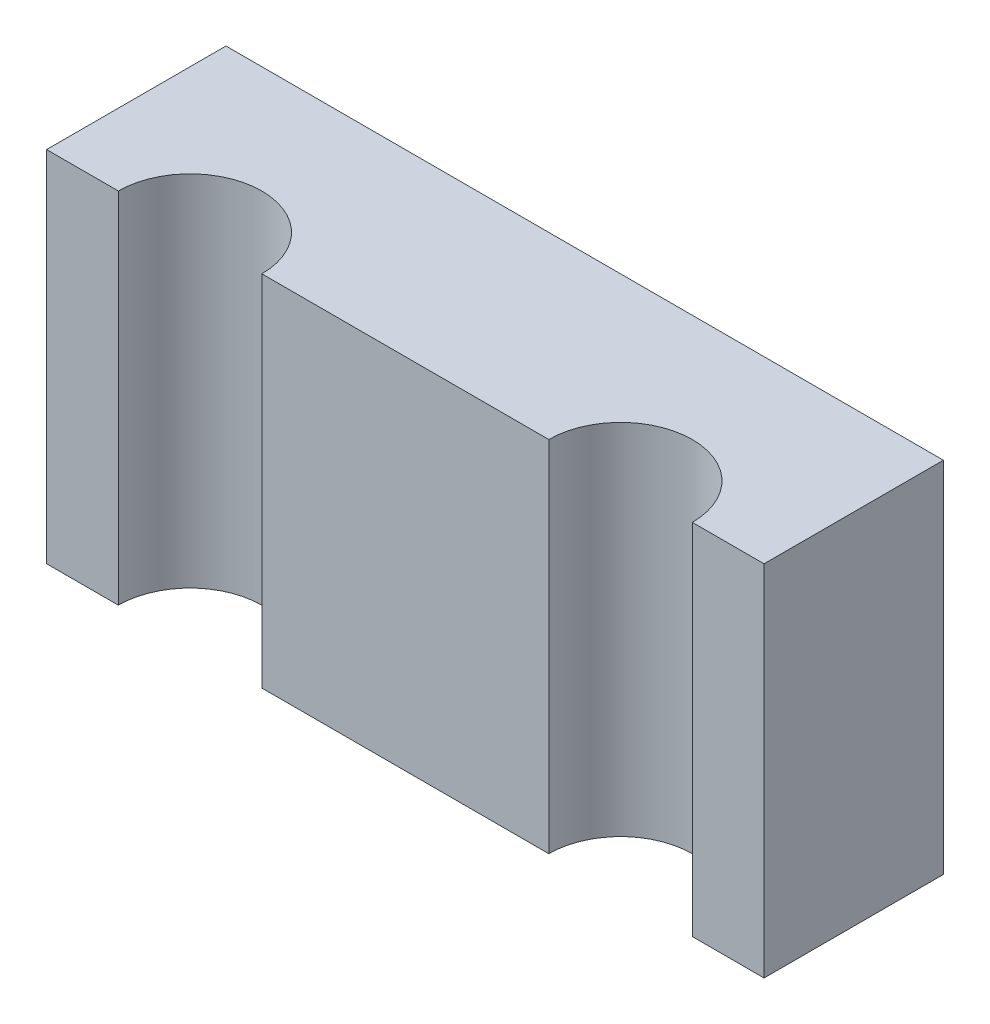
from build123d import *

# Parameters (mm, degrees)
SKIZZE1_W                       = 100
SKIZZE1_H                       = 50
AUFSATZ_LINEAR_AUSTRAGEN2_DEPTH = 25
SKIZZE4_R                       = 10
SCHNITT_LINEAR_AUSTRAGEN3_DEPTH = 115.564392374
SKIZZE5_W                       = 90
SKIZZE5_H                       = 40
SCHNITT_LINEAR_AUSTRAGEN4_DEPTH = 10
SKIZZE7_W                       = 25
SKIZZE7_H                       = 40
SCHNITT_LINEAR_AUSTRAGEN5_DEPTH = 10
VERRUNDUNG1_R                   = 10
VERRUNDUNG2_R                   = 10
SKIZZE8_W                       = 2
SKIZZE8_H                       = 40
SCHNITT_LINEAR_AUSTRAGEN6_DEPTH = 10
VERRUNDUNG3_R                   = 10


with BuildPart() as part:
    # Skizze1 → Aufsatz-Linear austragen2 (new body)
    with BuildSketch(Plane.XY):
        with Locations((50, 25)):
            Rectangle(SKIZZE1_W, SKIZZE1_H)
    extrude(amount=AUFSATZ_LINEAR_AUSTRAGEN2_DEPTH)

    # Skizze4 → Schnitt-Linear austragen3 (cut, through all)
    with BuildSketch(Plane(origin=(0, 50, 0), x_dir=(1, 0, 0), z_dir=(0, 1, 0))):
        with Locations((20, -25)):
            Circle(SKIZZE4_R)
        with Locations((80, -25)):
            Circle(SKIZZE4_R)
    extrude(amount=-SCHNITT_LINEAR_AUSTRAGEN3_DEPTH, mode=Mode.SUBTRACT)

    # Skizze5 → Schnitt-Linear austragen4 (cut)
    with BuildSketch(Plane(origin=(0, 0, 0), x_dir=(-1, 0, 0), z_dir=(0, 0, -1))):
        with Locations((-50, 25)):
            Rectangle(SKIZZE5_W, SKIZZE5_H)
    extrude(amount=-SCHNITT_LINEAR_AUSTRAGEN4_DEPTH, mode=Mode.SUBTRACT)

    # Skizze7 → Schnitt-Linear austragen5 (cut)
    with BuildSketch(Plane(origin=(0, 0, 10), x_dir=(-1, 0, 0), z_dir=(0, 0, -1))):
        with Locations((-50, 25)):
            Rectangle(SKIZZE7_W, SKIZZE7_H)
    extrude(amount=-SCHNITT_LINEAR_AUSTRAGEN5_DEPTH, mode=Mode.SUBTRACT)

    # Verrundung1
    verrundung1_edges = [part.edges().sort_by_distance(p)[0] for p in [
        (37.5, 25, 10),
    ]]
    fillet(verrundung1_edges, radius=VERRUNDUNG1_R - 0.0001)  # a hair under: the kernel refuses the full size

    # Verrundung2
    verrundung2_edges = [part.edges().sort_by_distance(p)[0] for p in [
        (62.5, 25, 10),
    ]]
    fillet(verrundung2_edges, radius=VERRUNDUNG2_R - 0.0001)  # a hair under: the kernel refuses the full size

    # Skizze8 → Schnitt-Linear austragen6 (cut)
    with BuildSketch(Plane(origin=(0, 0, 10), x_dir=(-1, 0, 0), z_dir=(0, 0, -1))):
        with Locations((-94, 25)):
            Rectangle(SKIZZE8_W, SKIZZE8_H)
    extrude(amount=-SCHNITT_LINEAR_AUSTRAGEN6_DEPTH, mode=Mode.SUBTRACT)

    # Verrundung3
    verrundung3_edges = [part.edges().sort_by_distance(p)[0] for p in [
        (93, 25, 10),
    ]]
    fillet(verrundung3_edges, radius=VERRUNDUNG3_R - 0.0001)  # a hair under: the kernel refuses the full size


solid = part.part
